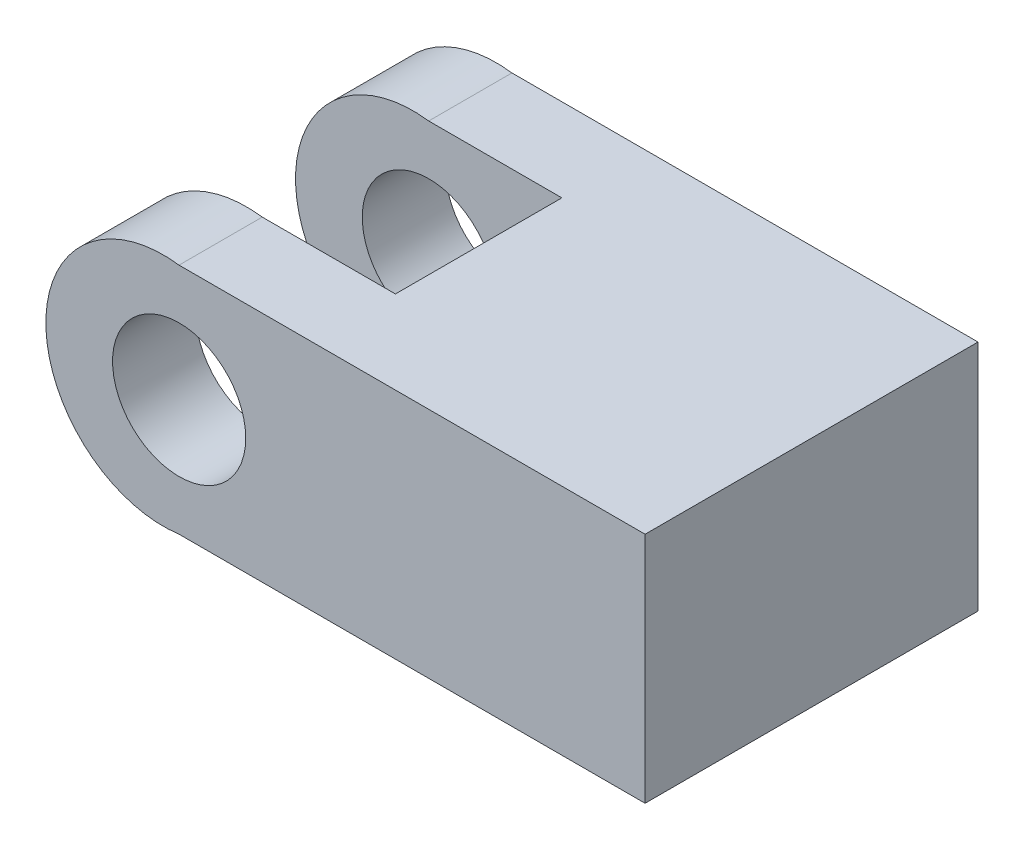
from build123d import *

# Parameters (mm, degrees)
ESQUISSE1_W                  = 10
ESQUISSE1_H                  = 10
BOSS_EXTRU_1_DEPTH           = 7
BOSS_EXTRU_2_DEPTH           = 10
ESQUISSE6_R                  = 2
ENL_V_MAT_EXTRU_1_DEPTH      = 16.793621388
ENL_V_MAT_EXTRU_3_DEPTH      = 10
ENL_V_MAT_EXTRU_3_DEPTH_BACK = 10
ESQUISSE7_W                  = 8.534065834
ESQUISSE7_H                  = 5


with BuildPart() as part:
    # Esquisse1 → Boss.-Extru.1 (new body)
    with BuildSketch(Plane(origin=(0, 0, 0), x_dir=(1, 0, 0), z_dir=(0, 1, 0))):
        with Locations((5, 5)):
            Rectangle(ESQUISSE1_W, ESQUISSE1_H)
    extrude(amount=BOSS_EXTRU_1_DEPTH)

    # Esquisse2 → Boss.-Extru.2 (add)
    with BuildSketch(Plane.XY):
        with BuildLine():
            Line((0, 7), (0, 0))
            Line((0, 0), (-4, 0))
            ThreePointArc((-4, 0), (-8, 3.5), (-4, 7))
            Line((-4, 7), (0, 7))
        make_face()
    extrude(amount=-BOSS_EXTRU_2_DEPTH)

    # Esquisse6 → Enlèv. mat.-Extru.1 (cut, through all)
    with BuildSketch(Plane.XY):
        with Locations((-3.99631755, 3.5)):
            Circle(ESQUISSE6_R)
    extrude(amount=-ENL_V_MAT_EXTRU_1_DEPTH, mode=Mode.SUBTRACT)

    # Esquisse7 → Enlèv. mat.-Extru.3 (cut, two sides: drawn at the far end of the back side and taken through both)
    with BuildSketch(Plane(origin=(0, 7, 0), x_dir=(1, 0, 0), z_dir=(0, 1, 0)).offset(-ENL_V_MAT_EXTRU_3_DEPTH_BACK)):
        with Locations((-4.267032917, 5)):
            Rectangle(ESQUISSE7_W, ESQUISSE7_H)
    extrude(amount=ENL_V_MAT_EXTRU_3_DEPTH + ENL_V_MAT_EXTRU_3_DEPTH_BACK, mode=Mode.SUBTRACT)


solid = part.part
